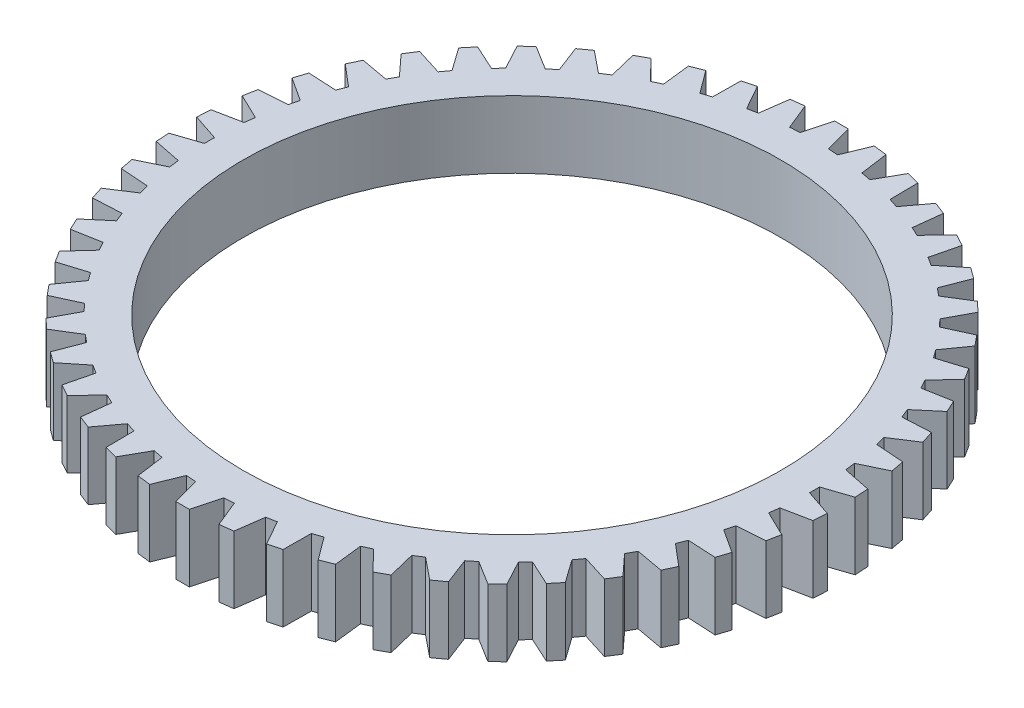
from build123d import *

# Parameters (mm, degrees)
SKETCH1_R           = 45
SKETCH1_R_2         = 40
BOSS_EXTRUDE1_DEPTH = 10
BOSS_EXTRUDE2_DEPTH = 10
CIRPATTERN1_COUNT   = 50


with BuildPart() as part:
    # Sketch1 → Boss-Extrude1 (new body)
    with BuildSketch(Plane(origin=(0, 0, 0), x_dir=(1, 0, 0), z_dir=(0, 1, 0))):
        with Locations(Location((0, 0, 0), (0, 0, 270))):
            Circle(SKETCH1_R)
        with Locations(Location((0, 0, 0), (0, 0, 270))):
            Circle(SKETCH1_R_2, mode=Mode.SUBTRACT)
    extrude(amount=BOSS_EXTRUDE1_DEPTH)

    # Sketch2 → Boss-Extrude2 (add)
    with BuildSketch(Plane(origin=(0, 0, 0), x_dir=(1, 0, 0), z_dir=(0, 1, 0))):
        Polygon((1, 49), (-1, 49), (-3.411542732, 40), (3.411542732, 40), align=None)
    boss_extrude2 = extrude(amount=BOSS_EXTRUDE2_DEPTH)

    # CirPattern1: Boss-Extrude2 ×50 about axis
    cirpattern1_axis = Axis((0, 0, 0), (0, 1, 0))
    for i in range(1, CIRPATTERN1_COUNT):
        add(boss_extrude2.rotate(cirpattern1_axis, i * 360 / CIRPATTERN1_COUNT))


solid = part.part
